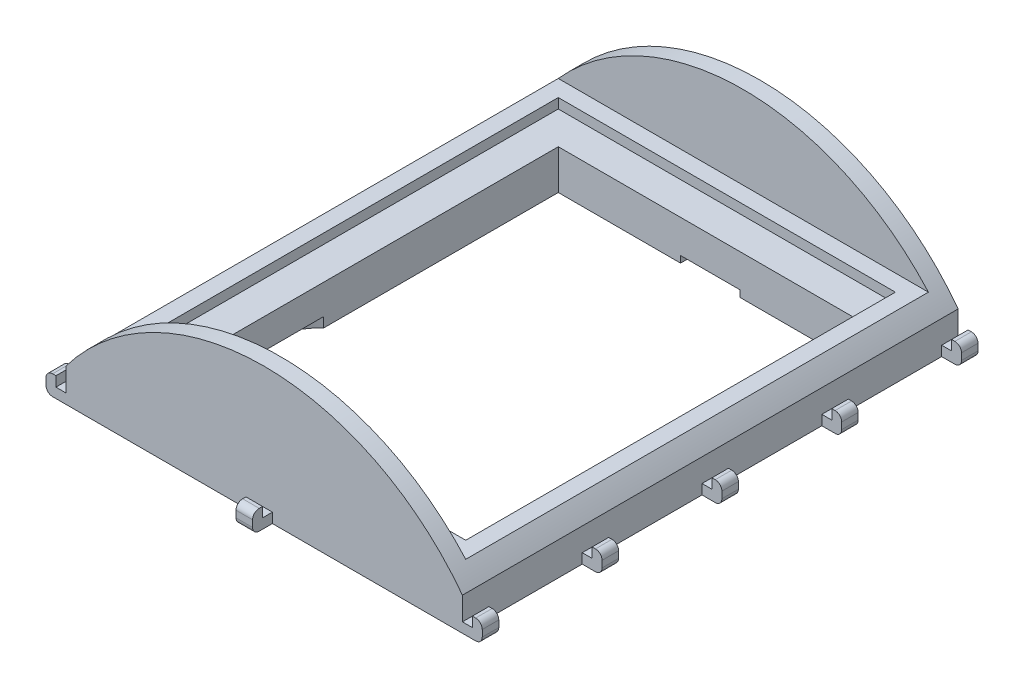
from build123d import *

# Parameters (mm, degrees)
SKETCH2_W              = 120
SKETCH2_H              = 15
BOSS_EXTRUDE1_DEPTH    = 150
BOSS_EXTRUDE3_DEPTH    = 150
SKETCH7_W              = 112
SKETCH7_H              = 140
CUT_EXTRUDE1_DEPTH     = 165.890873004
SKETCH8_W              = 92
SKETCH8_H              = 120
CUT_EXTRUDE2_DEPTH     = 165.890873004
SKETCH12_OUTSIDE_W     = 161.458
SKETCH12_OUTSIDE_H     = 191.458
SKETCH12_OUTSIDE_W_2   = 110
SKETCH12_OUTSIDE_H_2   = 140
CUT_EXTRUDE5_DEPTH     = 5
BOSS_EXTRUDE4_REACH    = 163.342
SKETCH14_W             = 112
SKETCH14_H             = 3
CUT_EXTRUDE6_REACH     = 165.495
SKETCH15_W             = 102
SKETCH15_H             = 130
SKETCH16_W             = 5
SKETCH16_H             = 6
BOSS_EXTRUDE5_DEPTH    = 6
CUT_EXTRUDE7_REACH     = 170.114
SKETCH17_W             = 3
SKETCH17_H             = 3
FILLET1_R              = 2
LPATTERN1_COUNT        = 5
LPATTERN1_PITCH        = 36.25
FILLET1_OF_LPATTERN1_R = 2
MIRROR1_DEPTH          = 5
MIRROR1_START          = 36.25
MIRROR1_2_DEPTH        = 5
MIRROR1_START_2        = 72.5
MIRROR1_3_DEPTH        = 5
MIRROR1_START_3        = 108.75
MIRROR1_4_DEPTH        = 5
MIRROR1_START_4        = 145
MIRROR1_5_DEPTH        = 5
SKETCH18_W             = 5
SKETCH18_H             = 6
BOSS_EXTRUDE6_DEPTH    = 6
CUT_EXTRUDE8_REACH     = 171.111
SKETCH19_W             = 3
SKETCH19_H             = 3
FILLET2_R              = 2
FILLET2_OF_MIRROR2_R   = 2
SKETCH20_R             = 23
CUT_EXTRUDE9_DEPTH     = 3
SKETCH21_W             = 18
SKETCH21_H             = 6
CUT_EXTRUDE10_DEPTH    = 2


# Read off the part's stored shape, not the designer's step: Mirror1
with BuildPart() as part:
    # Sketch2 → Boss-Extrude1 (new body)
    with BuildSketch(Plane.XY):
        Rectangle(SKETCH2_W, SKETCH2_H)
    extrude(amount=BOSS_EXTRUDE1_DEPTH)

    # Sketch4 → Boss-Extrude3 (add)
    with BuildSketch(Plane(origin=(0, 0, 0), x_dir=(-1, 0, 0), z_dir=(0, 0, -1))):
        with BuildLine():
            Line((-60, 7.5), (60, 7.5))
            ThreePointArc((60, 7.5), (0, 37.5), (-60, 7.5))
        make_face()
    extrude(amount=-BOSS_EXTRUDE3_DEPTH)

    # Sketch7 → Cut-Extrude1 (cut, through all)
    with BuildSketch(Plane(origin=(0, 4.5, 0), x_dir=(-1, 0, 0), z_dir=(0, -1, 0))):
        with Locations((0, -75)):
            Rectangle(SKETCH7_W, SKETCH7_H)
    extrude(amount=-CUT_EXTRUDE1_DEPTH, mode=Mode.SUBTRACT)

    # Sketch8 → Cut-Extrude2 (cut, through all)
    with BuildSketch(Plane(origin=(0, 4.5, 0), x_dir=(1, 0, 0), z_dir=(0, 1, 0))):
        with Locations((0, -75)):
            Rectangle(SKETCH8_W, SKETCH8_H)
    extrude(amount=-CUT_EXTRUDE2_DEPTH, mode=Mode.SUBTRACT)

    # Sketch12 outside → Cut-Extrude5 (cut)
    with BuildSketch(Plane(origin=(0, -7.5, 0), x_dir=(-1, 0, 0), z_dir=(0, -1, 0))):
        with Locations((0, -75)):
            Rectangle(SKETCH12_OUTSIDE_W, SKETCH12_OUTSIDE_H)
        with Locations((0, -75)):
            Rectangle(SKETCH12_OUTSIDE_W_2, SKETCH12_OUTSIDE_H_2, mode=Mode.SUBTRACT)
    extrude(amount=-CUT_EXTRUDE5_DEPTH, mode=Mode.SUBTRACT)

    # Sketch14 → Boss-Extrude4 (add, up to next)
    with BuildSketch(Plane.XY.offset(5), mode=Mode.PRIVATE) as boss_extrude4_sk1:
        with Locations((0, 10.889878733)):
            Rectangle(SKETCH14_W, SKETCH14_H)
    boss_extrude4_tool1 = extrude(boss_extrude4_sk1.sketch, amount=BOSS_EXTRUDE4_REACH, mode=Mode.PRIVATE) - part.part
    add(boss_extrude4_tool1.solids().sort_by_distance((0, 10.889879, 5))[0])

    # Sketch15 → Cut-Extrude6 (cut, up to next)
    with BuildSketch(Plane(origin=(0, 12.389878733, 0), x_dir=(1, 0, 0), z_dir=(0, 1, 0)), mode=Mode.PRIVATE) as cut_extrude6_sk1:
        with Locations((0, -75)):
            Rectangle(SKETCH15_W, SKETCH15_H)
    cut_extrude6_tool1 = extrude(cut_extrude6_sk1.sketch, amount=-CUT_EXTRUDE6_REACH, mode=Mode.PRIVATE) & part.part
    add(cut_extrude6_tool1.solids().sort_by_distance((0, 12.389879, 75))[0], mode=Mode.SUBTRACT)

    # Sketch16 → Boss-Extrude5 (add)
    with BuildSketch(Plane(origin=(60, 0, 0), x_dir=(0, 0, -1), z_dir=(1, 0, 0))):
        with Locations((-2.5, 0.5)):
            Rectangle(SKETCH16_W, SKETCH16_H)
    boss_extrude5 = extrude(amount=BOSS_EXTRUDE5_DEPTH)

    # Sketch17 → Cut-Extrude7 (cut, up to next)
    with BuildSketch(Plane(origin=(0, 0, 0), x_dir=(-1, 0, 0), z_dir=(0, 0, -1)), mode=Mode.PRIVATE) as cut_extrude7_sk1:
        with Locations((-61.5, 2)):
            Rectangle(SKETCH17_W, SKETCH17_H)
    cut_extrude7_tool1 = extrude(cut_extrude7_sk1.sketch, amount=-CUT_EXTRUDE7_REACH, mode=Mode.PRIVATE) & part.part
    cut_extrude7 = cut_extrude7_tool1.solids().sort_by_distance((61.5, 2, 0))[0]
    add(cut_extrude7, mode=Mode.SUBTRACT)

    # Fillet1
    fillet1_edges = [part.edges().sort_by_distance(p)[0] for p in [
        (66, 3.5, 2.5),
        (66, -2.5, 2.5),
    ]]
    fillet(fillet1_edges, radius=FILLET1_R)

    # LPattern1: Boss-Extrude5, Cut-Extrude7 ×5
    with Locations(*[(0, 0, i * LPATTERN1_PITCH) for i in range(1, LPATTERN1_COUNT)]):
        add(boss_extrude5)
        add(cut_extrude7, mode=Mode.SUBTRACT)

    # Fillet1 of LPattern1
    fillet1_of_lpattern1_edges = [part.edges().sort_by_distance(p)[0] for p in [
        (66, 3.5, 38.75),
        (66, -2.5, 38.75),
        (66, 3.5, 75),
        (66, -2.5, 75),
        (66, 3.5, 111.25),
        (66, -2.5, 111.25),
        (66, 3.5, 147.5),
        (66, -2.5, 147.5),
    ]]
    fillet(fillet1_of_lpattern1_edges, radius=FILLET1_OF_LPATTERN1_R)

    # Mirror1 outline → Mirror1 (add)
    with BuildSketch(Plane.XY):
        with BuildLine():
            Line((-63, 0.5), (-63, 3.5))
            Line((-63, 3.5), (-64, 3.5))
            ThreePointArc((-64, 3.5), (-65.414213562, 2.914213562), (-66, 1.5))
            Line((-66, 1.5), (-66, -0.5))
            ThreePointArc((-66, -0.5), (-65.414213562, -1.914213562), (-64, -2.5))
            Line((-64, -2.5), (-60, -2.5))
            Line((-60, -2.5), (-60, 0.5))
            Line((-60, 0.5), (-63, 0.5))
        make_face()
    extrude(amount=MIRROR1_DEPTH)

    # Mirror1 2 outline → Mirror1 2 (add)
    with BuildSketch(Plane.XY.offset(MIRROR1_START)):
        with BuildLine():
            Line((-63, 0.5), (-63, 3.5))
            Line((-63, 3.5), (-64, 3.5))
            ThreePointArc((-64, 3.5), (-65.414213562, 2.914213562), (-66, 1.5))
            Line((-66, 1.5), (-66, -0.5))
            ThreePointArc((-66, -0.5), (-65.414213562, -1.914213562), (-64, -2.5))
            Line((-64, -2.5), (-60, -2.5))
            Line((-60, -2.5), (-60, 0.5))
            Line((-60, 0.5), (-63, 0.5))
        make_face()
    extrude(amount=MIRROR1_2_DEPTH)

    # Mirror1 3 outline → Mirror1 3 (add)
    with BuildSketch(Plane.XY.offset(MIRROR1_START_2)):
        with BuildLine():
            Line((-63, 0.5), (-63, 3.5))
            Line((-63, 3.5), (-64, 3.5))
            ThreePointArc((-64, 3.5), (-65.414213562, 2.914213562), (-66, 1.5))
            Line((-66, 1.5), (-66, -0.5))
            ThreePointArc((-66, -0.5), (-65.414213562, -1.914213562), (-64, -2.5))
            Line((-64, -2.5), (-60, -2.5))
            Line((-60, -2.5), (-60, 0.5))
            Line((-60, 0.5), (-63, 0.5))
        make_face()
    extrude(amount=MIRROR1_3_DEPTH)

    # Mirror1 4 outline → Mirror1 4 (add)
    with BuildSketch(Plane.XY.offset(MIRROR1_START_3)):
        with BuildLine():
            Line((-63, 0.5), (-63, 3.5))
            Line((-63, 3.5), (-64, 3.5))
            ThreePointArc((-64, 3.5), (-65.414213562, 2.914213562), (-66, 1.5))
            Line((-66, 1.5), (-66, -0.5))
            ThreePointArc((-66, -0.5), (-65.414213562, -1.914213562), (-64, -2.5))
            Line((-64, -2.5), (-60, -2.5))
            Line((-60, -2.5), (-60, 0.5))
            Line((-60, 0.5), (-63, 0.5))
        make_face()
    extrude(amount=MIRROR1_4_DEPTH)

    # Mirror1 5 outline → Mirror1 5 (add)
    with BuildSketch(Plane.XY.offset(MIRROR1_START_4)):
        with BuildLine():
            Line((-63, 0.5), (-63, 3.5))
            Line((-63, 3.5), (-64, 3.5))
            ThreePointArc((-64, 3.5), (-65.414213562, 2.914213562), (-66, 1.5))
            Line((-66, 1.5), (-66, -0.5))
            ThreePointArc((-66, -0.5), (-65.414213562, -1.914213562), (-64, -2.5))
            Line((-64, -2.5), (-60, -2.5))
            Line((-60, -2.5), (-60, 0.5))
            Line((-60, 0.5), (-63, 0.5))
        make_face()
    extrude(amount=MIRROR1_5_DEPTH)

    # Sketch18 → Boss-Extrude6 (add)
    with BuildSketch(Plane(origin=(0, 0, 0), x_dir=(-1, 0, 0), z_dir=(0, 0, -1))):
        with Locations((0, 0.5)):
            Rectangle(SKETCH18_W, SKETCH18_H)
    boss_extrude6 = extrude(amount=BOSS_EXTRUDE6_DEPTH)

    # Sketch19 → Cut-Extrude8 (cut, up to next)
    with BuildSketch(Plane(origin=(2.5, 0, 0), x_dir=(0, 0, -1), z_dir=(1, 0, 0)), mode=Mode.PRIVATE) as cut_extrude8_sk1:
        with Locations((1.5, 2)):
            Rectangle(SKETCH19_W, SKETCH19_H)
    cut_extrude8_tool1 = extrude(cut_extrude8_sk1.sketch, amount=-CUT_EXTRUDE8_REACH, mode=Mode.PRIVATE) & part.part
    cut_extrude8 = cut_extrude8_tool1.solids().sort_by_distance((2.5, 2, -1.5))[0]
    add(cut_extrude8, mode=Mode.SUBTRACT)

    # Fillet2
    fillet2_edges = [part.edges().sort_by_distance(p)[0] for p in [
        (0, -2.5, -6),
        (0, 3.5, -6),
    ]]
    fillet(fillet2_edges, radius=FILLET2_R)

    # Mirror2: Boss-Extrude6, Cut-Extrude8 across plane
    add(boss_extrude6.mirror(Plane.XY.offset(75)))
    add(cut_extrude8.mirror(Plane.XY.offset(75)), mode=Mode.SUBTRACT)

    # Fillet2 of Mirror2
    fillet2_of_mirror2_edges = [part.edges().sort_by_distance(p)[0] for p in [
        (0, -2.5, 156),
        (0, 3.5, 156),
    ]]
    fillet(fillet2_of_mirror2_edges, radius=FILLET2_OF_MIRROR2_R)

    # Sketch20 → Cut-Extrude9 (cut)
    with BuildSketch(Plane(origin=(0, -7.5, 0), x_dir=(-1, 0, 0), z_dir=(0, -1, 0))):
        with Locations((30, -102.5)):
            Circle(SKETCH20_R)
        with Locations((-30, -47.5)):
            Circle(SKETCH20_R)
    extrude(amount=-CUT_EXTRUDE9_DEPTH, mode=Mode.SUBTRACT)

    # Sketch21 → Cut-Extrude10 (cut)
    with BuildSketch(Plane(origin=(0, -7.5, 0), x_dir=(-1, 0, 0), z_dir=(0, -1, 0))):
        with Locations((0, -138)):
            Rectangle(SKETCH21_W, SKETCH21_H)
    cut_extrude10 = extrude(amount=-CUT_EXTRUDE10_DEPTH, mode=Mode.SUBTRACT)

    # Mirror3: Cut-Extrude10 across plane
    add(cut_extrude10.mirror(Plane.XY.offset(75)), mode=Mode.SUBTRACT)


solid = part.part
